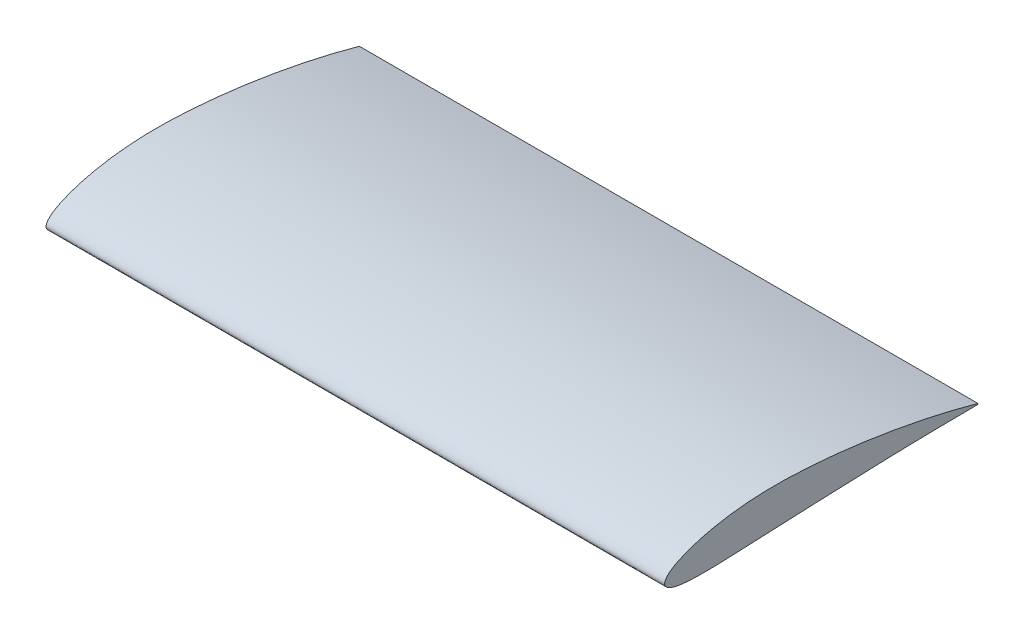
from build123d import *

# Parameters (mm, degrees)
BOSS_EXTRUDE1_DEPTH = 200
SHELL4_DEPTH        = 198.4


# Read off the part's stored shape, not the designer's step: Shell4
with BuildPart() as part:
    # Sketch2 → Boss-Extrude1 (new body)
    with BuildSketch(Plane.YZ):
        with BuildLine():
            Line((0, 0), (-0.263344105, 0))
            add(Edge.make_bspline(
                [(0, 0), (0.459066026, 1.686362772), (1.374982687, 5.050950153), (3.040345111, 11.79119389), (4.880368033, 20.220100989), (6.69419046, 30.358473989), (8.180959946, 40.488987495), (9.241471816, 50.625145633), (9.902902817, 60.760420595), (9.909592193, 69.221469875), (9.442212528, 75.9771391), (8.826589369, 81.050736595), (7.918723829, 86.135299513), (6.826886743, 90.348697601), (5.724176768, 93.725115323), (4.683167586, 96.271012337), (3.557343646, 98.44331039), (2.210659682, 100.328866881), (0.044765725, 101.970256047), (-1.611665434, 100.198592433), (-2.261876263, 98.390784877), (-2.700739943, 96.237810408), (-2.923870526, 93.695152896), (-3.081784432, 90.314927071), (-3.069956573, 86.092208181), (-2.92820834, 81.026757417), (-2.658310189, 75.964880802), (-2.342503562, 69.212441369), (-1.937238587, 60.773333491), (-1.556691614, 50.642805056), (-1.134126639, 40.51553101), (-0.774209635, 30.387287933), (-0.509468098, 20.258233454), (-0.375051203, 11.816976137), (-0.286530734, 5.064463666), (-0.271072843, 1.688124171), (-0.263344105, 0)],
                knots=[0, 0, 0, 0, 0.025304886, 0.050487653, 0.100520433, 0.150190716, 0.199586607, 0.248740009, 0.297715539, 0.346600594, 0.371102737, 0.395726297, 0.420570145, 0.445825119, 0.458702216, 0.471919982, 0.485786003, 0.493461051, 0.506863029, 0.51614777, 0.522766003, 0.535269014, 0.547551134, 0.559786371, 0.584228898, 0.60868081, 0.633151284, 0.657621757, 0.706558114, 0.75548187, 0.804405627, 0.853320224, 0.902221408, 0.951113136, 0.975557228, 1, 1, 1, 1], degree=3))
        make_face()
    extrude(amount=BOSS_EXTRUDE1_DEPTH)

    # Shell4 outline → Shell4 (cut)
    with BuildSketch(Plane.YZ):
        with BuildLine():
            add(Edge.make_bspline(
                [(1.229909583, 11.233204072), (1.259792724, 11.360590547), (1.289612362, 11.487991708), (1.319368458, 11.615407518), (1.349060906, 11.742837688), (1.378689543, 11.870281856), (1.408254283, 11.997740134), (1.437755285, 12.125213335), (1.467192791, 12.252701918), (1.49656654, 12.380204546), (1.525875672, 12.507719636), (1.555120364, 12.63524903), (1.584302543, 12.762795713), (1.613419448, 12.890353922), (1.745480409, 13.470239376), (1.847681658, 13.922729863), (1.94907388, 14.375397136), (2.049654735, 14.828239842), (2.149421882, 15.28125663), (2.248372982, 15.734446147), (2.346505693, 16.187807044), (2.443817676, 16.641337965), (2.540306589, 17.095037562), (2.635970093, 17.54890448), (2.730805847, 18.002937369), (2.82481151, 18.457134876), (2.917984743, 18.91149565), (3.056492434, 19.593279683), (3.102453373, 19.820581376), (3.148202951, 20.047921102), (3.193748261, 20.275311958), (3.239081627, 20.502731215), (3.284200074, 20.73017853), (3.32910992, 20.957678355), (3.373816805, 21.185242861), (3.418318772, 21.412855256), (3.46261158, 21.640496582), (3.506698265, 21.86817944), (3.550585835, 22.095927412), (3.59426776, 22.323706537), (3.681228971, 22.779359505), (3.724507647, 23.007230294), (3.767585292, 23.235145062), (3.810462803, 23.463103482), (3.853141076, 23.691105226), (3.895621011, 23.919149971), (3.937903503, 24.147237382), (3.979989451, 24.375367142), (4.021879752, 24.603538916), (4.063575302, 24.831752383), (4.105077001, 25.060007212), (4.146385744, 25.288303079), (4.187502429, 25.516639655), (4.269353479, 25.973393573), (4.310087844, 26.201810915), (4.350631946, 26.430268312), (4.390986685, 26.658765436), (4.431152958, 26.88730196), (4.471131663, 27.115877555), (4.510923698, 27.344491896), (4.550529962, 27.573144652), (4.589951354, 27.801835497), (4.62918877, 28.030564103), (4.668243109, 28.259330142), (4.70711527, 28.488133287), (4.74580615, 28.716973209), (4.822827146, 29.174725954), (4.861158224, 29.403639754), (4.899299337, 29.632572906), (4.937318423, 29.86166373), (4.974964003, 30.090265851), (5.012908235, 30.320410548), (5.049840992, 30.54754142), (5.087662058, 30.779095142), (5.12434976, 31.00625133), (5.161469948, 31.236516446), (5.198128377, 31.465284457), (5.234693411, 31.694583126), (5.271055963, 31.92379299), (5.379591358, 32.61151584), (5.45120465, 33.070077022), (5.522061807, 33.528717658), (5.592150332, 33.987437919), (5.661457729, 34.446237982), (5.7299715, 34.905118012), (5.79767915, 35.36407819), (5.86456818, 35.82311868), (5.930626094, 36.282239662), (5.995840396, 36.741441302), (6.060198588, 37.200723777), (6.123688173, 37.660087257), (6.186296656, 38.119531916), (6.278868979, 38.808820929), (6.309502529, 39.038603815), (6.339914907, 39.268412684), (6.37008791, 39.498214592), (6.400057248, 39.728106857), (6.429773492, 39.957926575), (6.459257957, 40.187794765), (6.488537031, 40.417781005), (6.517563465, 40.647676021), (6.546330451, 40.877522979), (6.574902484, 41.107613508), (6.603217247, 41.337582334), (6.631305832, 41.567635251), (6.687014735, 42.02778664), (6.714636038, 42.257892961), (6.742024498, 42.488029627), (6.769180423, 42.718196359), (6.796104118, 42.948392879), (6.822795891, 43.178618904), (6.849256049, 43.408874158), (6.875484896, 43.639158357), (6.901482742, 43.869471226), (6.927249891, 44.099812481), (6.952786652, 44.330181846), (6.978093329, 44.560579038), (7.00317023, 44.79100378), (7.052865094, 45.251907802), (7.077483056, 45.482387082), (7.101871855, 45.712893351), (7.126031799, 45.943426328), (7.149963193, 46.173985737), (7.173666344, 46.404571291), (7.19714156, 46.635182718), (7.220389147, 46.865819729), (7.243409412, 47.096482053), (7.266202661, 47.327169403), (7.288769201, 47.557881503), (7.311109339, 47.788618071), (7.333223383, 48.019378828), (7.376999892, 48.480948158), (7.398663398, 48.711766567), (7.420091509, 48.942512842), (7.441340973, 49.17374422), (7.462225343, 49.403558702), (7.483183179, 49.636594053), (7.503453208, 49.864374909), (7.524029384, 50.098742785), (7.543949402, 50.327021117), (7.563874261, 50.559429156), (7.58352188, 50.790029108), (7.602940478, 51.021108888), (7.622131794, 51.252111586), (7.67899804, 51.945122148), (7.715968154, 52.407113529), (7.751966518, 52.869088708), (7.786962121, 53.331047152), (7.820923977, 53.792988335), (7.85382112, 54.254911734), (7.885622609, 54.716816844), (7.916297524, 55.178703155), (7.945814971, 55.640570174), (7.974144074, 56.102417409), (8.001253986, 56.564244382), (8.027113877, 57.026050614), (8.051692943, 57.487835642), (8.098227862, 58.411362367), (8.120182792, 58.873106454), (8.140803752, 59.334815888), (8.16001519, 59.796516367), (8.177916859, 60.258266494), (8.194233799, 60.719691449), (8.209210922, 61.181561535), (8.222700732, 61.643216258), (8.23453299, 62.104460844), (8.244933259, 62.566251522), (8.253646095, 63.027506749), (8.260754868, 63.488898782), (8.266183775, 63.950146225), (8.273630637, 64.872463965), (8.275647706, 65.333526406), (8.27592387, 65.794484955), (8.274424697, 66.255329912), (8.271115798, 66.71605136), (8.265962788, 67.17664004), (8.258931288, 67.637087449), (8.24998694, 68.097385386), (8.239095425, 68.557525388), (8.226222485, 69.017498219), (8.211333919, 69.477293885), (8.194395557, 69.93690235), (8.175373194, 70.396315378), (8.133091733, 71.3147441), (8.109832632, 71.7737904), (8.084426317, 72.232659666), (8.056873938, 72.691330348), (8.02710712, 73.149780391), (7.995154157, 73.608050856), (7.960977641, 74.066048221), (7.924521949, 74.523765765), (7.885802648, 74.981306232), (7.844811884, 75.438563477), (7.801468846, 75.895379426), (7.755793845, 76.352081193), (7.707765463, 76.808413236), (7.632165036, 77.492454118), (7.606372049, 77.720388858), (7.579984142, 77.948242933), (7.55299924, 78.176014572), (7.525415268, 78.403701995), (7.497230152, 78.631303434), (7.468441815, 78.858817102), (7.439048184, 79.08624124), (7.409047183, 79.313574056), (7.378436738, 79.540813789), (7.347214772, 79.767958654), (7.315379212, 79.995006882), (7.282927982, 80.221956694), (7.23332452, 80.562231129), (7.216635154, 80.675635648), (7.199795012, 80.788980343), (7.182787398, 80.902393967), (7.165638521, 81.015696738), (7.148340392, 81.128917774), (7.130875964, 81.24215704), (7.113251292, 81.355374716), (7.095476759, 81.468496384), (7.077541771, 81.581573632), (7.059435892, 81.694663326), (7.041176083, 81.8076566), (7.022748176, 81.920627019), (6.985562534, 82.14646947), (6.966804118, 82.25934528), (6.94787878, 82.37217505), (6.928785195, 82.484958151), (6.909522033, 82.597693961), (6.89008797, 82.710381848), (6.870481678, 82.823021192), (6.850701831, 82.935611361), (6.830747101, 83.048151734), (6.810616162, 83.160641681), (6.790307688, 83.273080578), (6.76982035, 83.385467797), (6.749152823, 83.497802713), (6.707454737, 83.722366686), (6.686424178, 83.834595741), (6.665210785, 83.946771246), (6.643813239, 84.058892589), (6.62223022, 84.170959145), (6.600460412, 84.28297031), (6.578502493, 84.394925449), (6.556355148, 84.506823968), (6.534017054, 84.618665227), (6.511486896, 84.730448628), (6.488763352, 84.842173542), (6.465845106, 84.95383936), (6.442730837, 85.065445461), (6.396107618, 85.288536998), (6.372599387, 85.400017649), (6.348884752, 85.51148476), (6.325008817, 85.622672284), (6.300820029, 85.73438517), (6.276620727, 85.845088287), (6.252048359, 85.95649453), (6.227268992, 86.067899979), (6.202442541, 86.178503978), (6.177214963, 86.289929517), (6.151910157, 86.400734314), (6.126343242, 86.511722744), (6.1005825, 86.622600373), (6.022671503, 86.955097057), (5.969899131, 87.17655199), (5.916293116, 87.397794375), (5.861851526, 87.61882119), (5.806572425, 87.839629408), (5.750453882, 88.060216008), (5.693493962, 88.280577962), (5.635690731, 88.50071225), (5.577042255, 88.720615844), (5.517546601, 88.940285723), (5.457201834, 89.159718861), (5.396006022, 89.378912233), (5.333957231, 89.597862817), (5.2553276, 89.87124378), (5.239548241, 89.925904612), (5.223715419, 89.980550036), (5.207829104, 90.035180007), (5.191889265, 90.089794476), (5.175895872, 90.144393399), (5.159848895, 90.198976724), (5.143748304, 90.253544412), (5.127594067, 90.308096408), (5.111386155, 90.362632672), (5.095124538, 90.417153153), (5.078809185, 90.471657806), (5.062440065, 90.526146583), (5.029594233, 90.635092294), (5.013117085, 90.689551353), (4.99659741, 90.743951911), (4.979949467, 90.798597923), (4.963458298, 90.852514356), (4.946657907, 90.907253937), (4.929970063, 90.961423535), (4.91326504, 91.015436729), (4.896326358, 91.070010277), (4.879537352, 91.12388061), (4.862563949, 91.178137936), (4.845591923, 91.232172833), (4.828551348, 91.286209843), (4.777268947, 91.448171545), (4.742859625, 91.555969067), (4.70822302, 91.663584643), (4.673352932, 91.771013285), (4.638243187, 91.87825001), (4.602887633, 91.985289858), (4.567280148, 92.092127859), (4.531414634, 92.198759081), (4.495285018, 92.305178573), (4.458885254, 92.411381421), (4.422209321, 92.517362702), (4.385251224, 92.623117516), (4.348004993, 92.728640966), (4.291694531, 92.886571772), (4.27285173, 92.939153546), (4.253926776, 92.991699766), (4.234958025, 93.044093309), (4.215848119, 93.096614221), (4.196724847, 93.148898365), (4.177537049, 93.201078553), (4.158194693, 93.253409039), (4.138791596, 93.305633309), (4.1193626, 93.357648182), (4.099772779, 93.409823442), (4.080144477, 93.461825179), (4.06041586, 93.513818849), (4.020790638, 93.617699714), (4.000891916, 93.669592591), (3.980906356, 93.721438481), (3.960833235, 93.773237951), (3.940671827, 93.824991569), (3.920421408, 93.876699903), (3.900081253, 93.928363522), (3.879650637, 93.979982994), (3.859128836, 94.031558885), (3.838515124, 94.083091765), (3.817808777, 94.134582201), (3.79700907, 94.186030762), (3.776115279, 94.237438015), (3.734138076, 94.340171042), (3.713054668, 94.391496818), (3.691875712, 94.442782441), (3.670600468, 94.494028495), (3.649228197, 94.545235556), (3.627758159, 94.59640422), (3.606189613, 94.647535054), (3.584521821, 94.698628658), (3.562754041, 94.749685598), (3.540885534, 94.800706471), (3.51891556, 94.851691851), (3.49684338, 94.902642326), (3.474668252, 94.953558477), (3.441250031, 95.029882091), (3.430084699, 95.055314863), (3.418893348, 95.080739276), (3.407675884, 95.106155407), (3.396432214, 95.13156332), (3.385162242, 95.156963107), (3.373865875, 95.182354817), (3.362543019, 95.207738553), (3.35119358, 95.233114361), (3.339817463, 95.258482337), (3.328414575, 95.28384254), (3.316984821, 95.309195053), (3.305528108, 95.334539945), (3.282560574, 95.38521464), (3.271050422, 95.410542849), (3.259506956, 95.435877903), (3.247961299, 95.461148428), (3.236332851, 95.486536185), (3.224738727, 95.511780224), (3.213113542, 95.537022677), (3.201387997, 95.562419321), (3.189682248, 95.58770674), (3.178013991, 95.612842178), (3.166224295, 95.638173746), (3.154473954, 95.663350688), (3.142679773, 95.688552837), (3.083607695, 95.814431427), (3.035978891, 95.914814275), (2.987978001, 96.014840737), (2.939604465, 96.114474342), (2.890858105, 96.213678499), (2.841739127, 96.312416517), (2.792248122, 96.410651574), (2.742386062, 96.50834676), (2.692154305, 96.605465027), (2.64155459, 96.701969237), (2.590589042, 96.797822122), (2.539260167, 96.892986314), (2.487570857, 96.987424326), (2.409501151, 97.127935678), (2.383388698, 97.174581897), (2.357187459, 97.221032528), (2.330897901, 97.267282877), (2.304520529, 97.313328269), (2.278055881, 97.359164), (2.251504535, 97.404785414), (2.224867104, 97.450187801), (2.198144236, 97.495366511), (2.171336616, 97.540316845), (2.144444968, 97.585034145), (2.117470048, 97.62951373), (2.090412652, 97.673750934), (2.05648885, 97.728738626), (2.049698986, 97.739720724), (2.042904032, 97.750687309), (2.036104001, 97.761638309), (2.029298909, 97.772573652), (2.022488769, 97.783493261), (2.015673596, 97.794397072), (2.008853403, 97.805285002), (2.002028204, 97.816156989), (1.995198013, 97.827012951), (1.988362845, 97.837852822), (1.981522714, 97.848676526), (1.974677633, 97.859483992), (1.9609776, 97.881066302), (1.954118784, 97.891847274), (1.947299039, 97.902542424), (1.940264418, 97.913551605), (1.93372599, 97.923757633), (1.926621049, 97.934826305), (1.919852251, 97.945343865), (1.913183357, 97.955678727), (1.906128964, 97.966591315), (1.899495265, 97.976819213), (1.892603109, 97.987424727), (1.885823938, 97.99782653), (1.87902182, 98.008236847), (1.858636847, 98.039351281), (1.84506231, 98.059959233), (1.831499942, 98.080434687), (1.817946424, 98.100780232), (1.804398387, 98.120998527), (1.790852418, 98.141092338), (1.777305056, 98.161064472), (1.763752795, 98.180917867), (1.75019208, 98.200655491), (1.736619312, 98.22028044), (1.723030843, 98.239795854), (1.709422982, 98.25920498), (1.695791988, 98.278511132), (1.654818248, 98.336130873), (1.627394524, 98.374145636), (1.599832648, 98.411788864), (1.572101305, 98.4490885), (1.544168142, 98.486073404), (1.515999794, 98.522773158), (1.487561906, 98.559217915), (1.458819157, 98.595438184), (1.429735282, 98.631464702), (1.400273101, 98.667328203), (1.370394535, 98.703059288), (1.340060637, 98.738688217), (1.309231611, 98.774244745), (1.270025645, 98.818636243), (1.262151756, 98.827510998), (1.254241746, 98.836385659), (1.246297664, 98.845257804), (1.238319763, 98.854126919), (1.23030602, 98.862994949), (1.22225423, 98.871863996), (1.214163834, 98.880734436), (1.206035986, 98.889604749), (1.197871737, 98.898473569), (1.189669527, 98.907342286), (1.181424588, 98.916215755), (1.173134155, 98.925096661), (1.156493412, 98.94283942), (1.148140903, 98.951703504), (1.139757156, 98.960559047), (1.131343066, 98.969404807), (1.122899532, 98.978239536), (1.114427451, 98.987061997), (1.105927721, 98.995870935), (1.097401238, 99.004665119), (1.0888489, 99.013443291), (1.080271605, 99.02220422), (1.07167025, 99.030946651), (1.063045732, 99.039669346), (1.05439895, 99.048371059), (1.028394498, 99.07440952), (1.010973131, 99.091679776), (0.993474053, 99.108851496), (0.975904796, 99.125914919), (0.958273067, 99.14286035), (0.940586748, 99.159678144), (0.922853896, 99.176358729), (0.905082744, 99.192892576), (0.8872817, 99.209270234), (0.869459349, 99.225482295), (0.851624448, 99.241519424), (0.833785932, 99.257372336), (0.815952912, 99.273031813), (0.746628729, 99.333168811), (0.695246473, 99.376157065), (0.644218204, 99.417230999), (0.593785058, 99.456178818), (0.544209051, 99.492794306), (0.495775931, 99.526880075), (0.448796187, 99.558253028), (0.403606837, 99.586749954), (0.360574357, 99.612233756), (0.32009737, 99.63460218), (0.282606427, 99.653800854), (0.248557415, 99.669841132), (0.218414842, 99.682820545), (0.192621393, 99.69293969)],
                knots=[0.054152956, 0.054152956, 0.054152956, 0.054152956, 0.054152956, 0.054152956, 0.054152956, 0.054152956, 0.054152956, 0.054152956, 0.054152956, 0.054152956, 0.054152956, 0.054152956, 0.054152956, 0.063043564, 0.063043564, 0.063043564, 0.063043564, 0.063043564, 0.063043564, 0.063043564, 0.063043564, 0.063043564, 0.063043564, 0.063043564, 0.063043564, 0.063043564, 0.094565346, 0.094565346, 0.094565346, 0.094565346, 0.094565346, 0.094565346, 0.094565346, 0.094565346, 0.094565346, 0.094565346, 0.094565346, 0.094565346, 0.094565346, 0.110326237, 0.110326237, 0.110326237, 0.110326237, 0.110326237, 0.110326237, 0.110326237, 0.110326237, 0.110326237, 0.110326237, 0.110326237, 0.110326237, 0.110326237, 0.126087127, 0.126087127, 0.126087127, 0.126087127, 0.126087127, 0.126087127, 0.126087127, 0.126087127, 0.126087127, 0.126087127, 0.126087127, 0.126087127, 0.126087127, 0.141848018, 0.141848018, 0.141848018, 0.141848018, 0.141848018, 0.141848018, 0.141848018, 0.141848018, 0.141848018, 0.141848018, 0.141848018, 0.141848018, 0.141848018, 0.157608909, 0.157608909, 0.157608909, 0.157608909, 0.157608909, 0.157608909, 0.157608909, 0.157608909, 0.157608909, 0.157608909, 0.157608909, 0.157608909, 0.157608909, 0.189130691, 0.189130691, 0.189130691, 0.189130691, 0.189130691, 0.189130691, 0.189130691, 0.189130691, 0.189130691, 0.189130691, 0.189130691, 0.189130691, 0.189130691, 0.204891582, 0.204891582, 0.204891582, 0.204891582, 0.204891582, 0.204891582, 0.204891582, 0.204891582, 0.204891582, 0.204891582, 0.204891582, 0.204891582, 0.204891582, 0.220652473, 0.220652473, 0.220652473, 0.220652473, 0.220652473, 0.220652473, 0.220652473, 0.220652473, 0.220652473, 0.220652473, 0.220652473, 0.220652473, 0.220652473, 0.236413364, 0.236413364, 0.236413364, 0.236413364, 0.236413364, 0.236413364, 0.236413364, 0.236413364, 0.236413364, 0.236413364, 0.236413364, 0.236413364, 0.236413364, 0.252174255, 0.252174255, 0.252174255, 0.252174255, 0.252174255, 0.252174255, 0.252174255, 0.252174255, 0.252174255, 0.252174255, 0.252174255, 0.252174255, 0.252174255, 0.283696037, 0.283696037, 0.283696037, 0.283696037, 0.283696037, 0.283696037, 0.283696037, 0.283696037, 0.283696037, 0.283696037, 0.283696037, 0.283696037, 0.283696037, 0.315217819, 0.315217819, 0.315217819, 0.315217819, 0.315217819, 0.315217819, 0.315217819, 0.315217819, 0.315217819, 0.315217819, 0.315217819, 0.315217819, 0.315217819, 0.3467396, 0.3467396, 0.3467396, 0.3467396, 0.3467396, 0.3467396, 0.3467396, 0.3467396, 0.3467396, 0.3467396, 0.3467396, 0.3467396, 0.3467396, 0.378261382, 0.378261382, 0.378261382, 0.378261382, 0.378261382, 0.378261382, 0.378261382, 0.378261382, 0.378261382, 0.378261382, 0.378261382, 0.378261382, 0.378261382, 0.394022273, 0.394022273, 0.394022273, 0.394022273, 0.394022273, 0.394022273, 0.394022273, 0.394022273, 0.394022273, 0.394022273, 0.394022273, 0.394022273, 0.394022273, 0.401902719, 0.401902719, 0.401902719, 0.401902719, 0.401902719, 0.401902719, 0.401902719, 0.401902719, 0.401902719, 0.401902719, 0.401902719, 0.401902719, 0.401902719, 0.409783164, 0.409783164, 0.409783164, 0.409783164, 0.409783164, 0.409783164, 0.409783164, 0.409783164, 0.409783164, 0.409783164, 0.409783164, 0.409783164, 0.409783164, 0.41766361, 0.41766361, 0.41766361, 0.41766361, 0.41766361, 0.41766361, 0.41766361, 0.41766361, 0.41766361, 0.41766361, 0.41766361, 0.41766361, 0.41766361, 0.425544055, 0.425544055, 0.425544055, 0.425544055, 0.425544055, 0.425544055, 0.425544055, 0.425544055, 0.425544055, 0.425544055, 0.425544055, 0.425544055, 0.425544055, 0.441304946, 0.441304946, 0.441304946, 0.441304946, 0.441304946, 0.441304946, 0.441304946, 0.441304946, 0.441304946, 0.441304946, 0.441304946, 0.441304946, 0.441304946, 0.445245169, 0.445245169, 0.445245169, 0.445245169, 0.445245169, 0.445245169, 0.445245169, 0.445245169, 0.445245169, 0.445245169, 0.445245169, 0.445245169, 0.445245169, 0.449185391, 0.449185391, 0.449185391, 0.449185391, 0.449185391, 0.449185391, 0.449185391, 0.449185391, 0.449185391, 0.449185391, 0.449185391, 0.449185391, 0.449185391, 0.457065837, 0.457065837, 0.457065837, 0.457065837, 0.457065837, 0.457065837, 0.457065837, 0.457065837, 0.457065837, 0.457065837, 0.457065837, 0.457065837, 0.457065837, 0.46100606, 0.46100606, 0.46100606, 0.46100606, 0.46100606, 0.46100606, 0.46100606, 0.46100606, 0.46100606, 0.46100606, 0.46100606, 0.46100606, 0.46100606, 0.464946282, 0.464946282, 0.464946282, 0.464946282, 0.464946282, 0.464946282, 0.464946282, 0.464946282, 0.464946282, 0.464946282, 0.464946282, 0.464946282, 0.464946282, 0.468886505, 0.468886505, 0.468886505, 0.468886505, 0.468886505, 0.468886505, 0.468886505, 0.468886505, 0.468886505, 0.468886505, 0.468886505, 0.468886505, 0.468886505, 0.470856617, 0.470856617, 0.470856617, 0.470856617, 0.470856617, 0.470856617, 0.470856617, 0.470856617, 0.470856617, 0.470856617, 0.470856617, 0.470856617, 0.470856617, 0.472826728, 0.472826728, 0.472826728, 0.472826728, 0.472826728, 0.472826728, 0.472826728, 0.472826728, 0.472826728, 0.472826728, 0.472826728, 0.472826728, 0.472826728, 0.480707173, 0.480707173, 0.480707173, 0.480707173, 0.480707173, 0.480707173, 0.480707173, 0.480707173, 0.480707173, 0.480707173, 0.480707173, 0.480707173, 0.480707173, 0.484647396, 0.484647396, 0.484647396, 0.484647396, 0.484647396, 0.484647396, 0.484647396, 0.484647396, 0.484647396, 0.484647396, 0.484647396, 0.484647396, 0.484647396, 0.485632452, 0.485632452, 0.485632452, 0.485632452, 0.485632452, 0.485632452, 0.485632452, 0.485632452, 0.485632452, 0.485632452, 0.485632452, 0.485632452, 0.485632452, 0.486617507, 0.486617507, 0.486617507, 0.486617507, 0.486617507, 0.486617507, 0.486617507, 0.486617507, 0.486617507, 0.486617507, 0.486617507, 0.486617507, 0.486617507, 0.488587619, 0.488587619, 0.488587619, 0.488587619, 0.488587619, 0.488587619, 0.488587619, 0.488587619, 0.488587619, 0.488587619, 0.488587619, 0.488587619, 0.488587619, 0.492527842, 0.492527842, 0.492527842, 0.492527842, 0.492527842, 0.492527842, 0.492527842, 0.492527842, 0.492527842, 0.492527842, 0.492527842, 0.492527842, 0.492527842, 0.493512897, 0.493512897, 0.493512897, 0.493512897, 0.493512897, 0.493512897, 0.493512897, 0.493512897, 0.493512897, 0.493512897, 0.493512897, 0.493512897, 0.493512897, 0.494497953, 0.494497953, 0.494497953, 0.494497953, 0.494497953, 0.494497953, 0.494497953, 0.494497953, 0.494497953, 0.494497953, 0.494497953, 0.494497953, 0.494497953, 0.496468064, 0.496468064, 0.496468064, 0.496468064, 0.496468064, 0.496468064, 0.496468064, 0.496468064, 0.496468064, 0.496468064, 0.496468064, 0.496468064, 0.496468064, 0.502162927, 0.502162927, 0.502162927, 0.502162927, 0.502162927, 0.502162927, 0.502162927, 0.502162927, 0.502162927, 0.502162927, 0.502162927, 0.502162927, 0.502162927, 0.502162927, 0.502162927], degree=14))
            add(Edge.make_bspline(
                [(0.192621393, 99.69293969), (0.185991198, 99.687611534), (0.179088374, 99.681936328), (0.171929352, 99.675916465), (0.164530528, 99.669554974), (0.156907888, 99.66285564), (0.149076983, 99.655822943), (0.141052909, 99.648461987), (0.132850308, 99.640778436), (0.124483378, 99.632778459), (0.115965891, 99.624468668), (0.107311237, 99.615856067), (0.098532464, 99.606948006), (0.089642342, 99.597752127), (0.070498141, 99.577570958), (0.060216557, 99.566508154), (0.049825987, 99.555099844), (0.039343199, 99.543358262), (0.028784439, 99.531295959), (0.018165421, 99.518925776), (0.007501335, 99.506260895), (-0.003193159, 99.493314766), (-0.013903926, 99.480101191), (-0.02461736, 99.466634243), (-0.035320382, 99.452928331), (-0.046000441, 99.438998158), (-0.056645511, 99.424858742), (-0.077842683, 99.396192073), (-0.088392206, 99.381668464), (-0.098896409, 99.366943367), (-0.109299136, 99.352108016), (-0.119655459, 99.337065973), (-0.129917008, 99.321896935), (-0.140045546, 99.306664266), (-0.150078538, 99.291303742), (-0.160021129, 99.275806677), (-0.169798627, 99.260300405), (-0.179407755, 99.244792009), (-0.188956869, 99.229100048), (-0.198255902, 99.213549475), (-0.225821487, 99.166623699), (-0.243701664, 99.13506691), (-0.261132679, 99.1031788), (-0.278157912, 99.070902097), (-0.294816785, 99.038180947), (-0.31114514, 99.004961228), (-0.327175619, 98.971190857), (-0.34293805, 98.936820095), (-0.358459818, 98.901801867), (-0.373766253, 98.866092059), (-0.388881006, 98.829649836), (-0.40382643, 98.792437946), (-0.418623962, 98.754423034), (-0.440629768, 98.696152404), (-0.447933447, 98.676520612), (-0.45520807, 98.656676837), (-0.4624562, 98.636617546), (-0.46968043, 98.616339391), (-0.476883381, 98.595839241), (-0.484067706, 98.575114129), (-0.491236085, 98.554161321), (-0.498391228, 98.53297824), (-0.505535877, 98.511562541), (-0.512672801, 98.489912046), (-0.519804799, 98.468024793), (-0.5269347, 98.445899003), (-0.535848028, 98.417941623), (-0.537630744, 98.412335129), (-0.539413558, 98.406713597), (-0.541196519, 98.401077002), (-0.542979673, 98.395425327), (-0.544763069, 98.389758542), (-0.546546754, 98.384076638), (-0.548330777, 98.378379577), (-0.550115184, 98.372667352), (-0.551900024, 98.366939931), (-0.553685344, 98.361197298), (-0.555471193, 98.355439427), (-0.557257617, 98.349666299), (-0.560831714, 98.338089484), (-0.562621349, 98.332279331), (-0.564395878, 98.326506038), (-0.566230684, 98.320520565), (-0.567932455, 98.314962448), (-0.569819691, 98.308777477), (-0.57157752, 98.303009788), (-0.57330902, 98.297315419), (-0.57519684, 98.291091068), (-0.576945996, 98.285316749), (-0.578742862, 98.279369435), (-0.580531914, 98.273437511), (-0.582315972, 98.26750968), (-0.58766179, 98.249711391), (-0.591214729, 98.237834084), (-0.594756736, 98.225945054), (-0.598287822, 98.21404435), (-0.601807994, 98.202132035), (-0.605317262, 98.19020815), (-0.608815635, 98.178272768), (-0.612303123, 98.166325922), (-0.615779734, 98.154367688), (-0.619245477, 98.142398103), (-0.622700361, 98.130417233), (-0.626144396, 98.118425127), (-0.62957759, 98.106421841), (-0.660378857, 97.998292138), (-0.687064455, 97.90146456), (-0.713061879, 97.80395306), (-0.738376636, 97.705786045), (-0.763014604, 97.606991958), (-0.786982033, 97.507599279), (-0.810285548, 97.407636532), (-0.832932144, 97.30713227), (-0.854929192, 97.206115095), (-0.876284433, 97.104613637), (-0.897005982, 97.002656574), (-0.917102326, 96.900272615), (-0.936582325, 96.797490511), (-0.964891656, 96.642763319), (-0.974176149, 96.591096027), (-0.983310165, 96.539338498), (-0.992294712, 96.48749523), (-1.001130768, 96.435571023), (-1.009819471, 96.383569749), (-1.01836213, 96.331494248), (-1.026760129, 96.279346989), (-1.035014793, 96.227130905), (-1.043127289, 96.174850082), (-1.051098625, 96.12250972), (-1.05892983, 96.070114992), (-1.066622366, 96.017668288), (-1.081735367, 95.912660549), (-1.089156155, 95.860097167), (-1.096443398, 95.807473889), (-1.103599264, 95.754790328), (-1.110625921, 95.702046101), (-1.117525536, 95.649240821), (-1.124300277, 95.596374106), (-1.130952311, 95.543445568), (-1.137483807, 95.490454824), (-1.143896931, 95.437401488), (-1.150193852, 95.384285176), (-1.156376738, 95.331105502), (-1.162447755, 95.277862082), (-1.180331706, 95.117939427), (-1.191815855, 95.011068216), (-1.202879083, 94.903938433), (-1.213539096, 94.796547733), (-1.223813742, 94.688893887), (-1.233721013, 94.580974787), (-1.24327904, 94.472788434), (-1.252506098, 94.364332959), (-1.261420603, 94.255606596), (-1.270041115, 94.146607709), (-1.278386332, 94.037334771), (-1.286475099, 93.927786376), (-1.2943264, 93.817961234), (-1.303867601, 93.680332409), (-1.305761555, 93.652798454), (-1.307646637, 93.625181913), (-1.309505408, 93.597746656), (-1.31137061, 93.569993719), (-1.31321527, 93.542370497), (-1.315037167, 93.51488692), (-1.316855496, 93.487228582), (-1.318662007, 93.459554139), (-1.320446211, 93.432029907), (-1.322225127, 93.404355687), (-1.323987101, 93.376751098), (-1.325736855, 93.34912284), (-1.329209807, 93.293864901), (-1.330933121, 93.266232641), (-1.332643303, 93.238597113), (-1.334340384, 93.210958341), (-1.336024395, 93.183316342), (-1.337695367, 93.15567115), (-1.33935333, 93.128022769), (-1.340998316, 93.100371244), (-1.342630354, 93.072716576), (-1.344249476, 93.045058805), (-1.345855713, 93.017397942), (-1.347449096, 92.989734015), (-1.349029654, 92.962067044), (-1.35373295, 92.87905707), (-1.356817307, 92.823705006), (-1.359850738, 92.768341039), (-1.36283349, 92.71296535), (-1.365765812, 92.657578118), (-1.368647949, 92.602179527), (-1.371480151, 92.546769749), (-1.374262665, 92.491348974), (-1.376995737, 92.435917374), (-1.379679616, 92.380475133), (-1.38231455, 92.32502243), (-1.384900785, 92.269559445), (-1.387438569, 92.214086358), (-1.394907312, 92.047637332), (-1.399693807, 91.936627693), (-1.404288773, 91.825601798), (-1.408696283, 91.714489671), (-1.412916124, 91.603388472), (-1.416950267, 91.492262117), (-1.420802538, 91.381055933), (-1.424475032, 91.269818896), (-1.427967681, 91.158605016), (-1.431281612, 91.047360735), (-1.434421447, 90.936029264), (-1.437392053, 90.824688813), (-1.440193134, 90.713306138), (-1.445464564, 90.490467115), (-1.447934641, 90.379010708), (-1.450241861, 90.267517478), (-1.452389006, 90.155987504), (-1.454378855, 90.044420849), (-1.45621419, 89.932817603), (-1.457897792, 89.821177818), (-1.45943244, 89.709501594), (-1.460820917, 89.597788979), (-1.462066002, 89.486040068), (-1.463170477, 89.37425492), (-1.464137122, 89.262433618), (-1.464968718, 89.150576231), (-1.466367374, 88.926789438), (-1.466934433, 88.814860038), (-1.46737204, 88.70289472), (-1.46768301, 88.590893569), (-1.46787016, 88.47885667), (-1.467936305, 88.366784108), (-1.467884262, 88.254675969), (-1.467716847, 88.142532336), (-1.467436876, 88.030353297), (-1.467047165, 87.918138935), (-1.46655053, 87.805889336), (-1.465949788, 87.693604584), (-1.465247754, 87.581284765), (-1.463646735, 87.356575164), (-1.462747724, 87.24419322), (-1.46175365, 87.131698996), (-1.460664558, 87.019550432), (-1.459491154, 86.906150483), (-1.458222023, 86.795509703), (-1.456874816, 86.680010584), (-1.455452273, 86.570873219), (-1.453926487, 86.455163969), (-1.452363736, 86.344494216), (-1.450689783, 86.230937917), (-1.448970555, 86.118369022), (-1.447176679, 86.005614745), (-1.44159131, 85.667404068), (-1.437593383, 85.441936202), (-1.433321063, 85.216474601), (-1.428774301, 84.991019606), (-1.423953054, 84.765571571), (-1.418857273, 84.540130825), (-1.413486913, 84.314697735), (-1.407841927, 84.08927262), (-1.401922269, 83.86385585), (-1.395727892, 83.638447749), (-1.38925875, 83.413048676), (-1.382514797, 83.187658969), (-1.375495986, 82.962278975), (-1.364555413, 82.62422407), (-1.36083983, 82.511541616), (-1.357055514, 82.398861719), (-1.353202461, 82.286184423), (-1.349280665, 82.173509771), (-1.34529012, 82.060837804), (-1.341230819, 81.94816857), (-1.337102758, 81.835502105), (-1.33290593, 81.72283846), (-1.32864033, 81.610177671), (-1.324305952, 81.497519786), (-1.31990279, 81.384864846), (-1.315430839, 81.272212894), (-1.306349344, 81.046915053), (-1.30173985, 80.93427726), (-1.297059521, 80.821585096), (-1.292312744, 80.708869457), (-1.287502493, 80.596141569), (-1.282630213, 80.483390324), (-1.277697495, 80.370606248), (-1.27270684, 80.257792744), (-1.267661123, 80.144958779), (-1.262562658, 80.032105484), (-1.257413044, 79.919223732), (-1.252214232, 79.806309151), (-1.246969526, 79.693376518), (-1.231102391, 79.354495142), (-1.220347557, 79.128471455), (-1.209433966, 78.902344233), (-1.198379634, 78.676112705), (-1.187202609, 78.449776101), (-1.175920971, 78.223333644), (-1.16455283, 77.996784568), (-1.153116329, 77.770128086), (-1.141629642, 77.543363429), (-1.130110973, 77.31648981), (-1.118578558, 77.089506454), (-1.107050666, 76.862412572), (-1.095545596, 76.635207382), (-1.081215699, 76.351060776), (-1.078352442, 76.294225117), (-1.07549135, 76.237382042), (-1.072634424, 76.180521487), (-1.069781034, 76.123683936), (-1.066929983, 76.066821614), (-1.064082696, 76.00991706), (-1.061241577, 75.95303142), (-1.05840627, 75.89619273), (-1.05557406, 75.839336661), (-1.052744885, 75.782438167), (-1.049922116, 75.725594526), (-1.047102448, 75.668727438), (-1.041471804, 75.555005184), (-1.038660615, 75.498145476), (-1.035853493, 75.441287191), (-1.033050371, 75.384430329), (-1.030251184, 75.327574897), (-1.027455865, 75.270720892), (-1.024664347, 75.213868324), (-1.021876565, 75.157017187), (-1.019092451, 75.100167493), (-1.01631194, 75.043319238), (-1.013534965, 74.986472428), (-1.010761459, 74.929627064), (-1.007991357, 74.87278315), (-0.999691063, 74.702255765), (-0.994170881, 74.588576651), (-0.988663516, 74.474903368), (-0.983168439, 74.361235938), (-0.97768512, 74.247574384), (-0.972213028, 74.133918726), (-0.966751633, 74.020268988), (-0.961300407, 73.906625191), (-0.955858818, 73.792987357), (-0.950426337, 73.679355508), (-0.945002434, 73.565729666), (-0.939586579, 73.452109853), (-0.934178242, 73.338496091), (-0.923375544, 73.111280712), (-0.917981183, 72.997679095), (-0.912593281, 72.884083573), (-0.90721131, 72.770494169), (-0.90183474, 72.6569109), (-0.896463043, 72.543333796), (-0.89109569, 72.429762869), (-0.885732152, 72.316198152), (-0.880371901, 72.202639656), (-0.875014407, 72.089087411), (-0.869659142, 71.975541434), (-0.864305578, 71.86200175), (-0.858953184, 71.748468378), (-0.848249682, 71.521414307), (-0.842898426, 71.407895573), (-0.837548034, 71.29436529), (-0.832196112, 71.180912565), (-0.826842243, 71.067316481), (-0.821491796, 70.953871861), (-0.816136282, 70.8404625), (-0.810772449, 70.726883614), (-0.805411204, 70.613352511), (-0.800052436, 70.499950464), (-0.794683832, 70.386369152), (-0.789319615, 70.272891599), (-0.783952299, 70.159377111), (-0.757112803, 69.591816205), (-0.735626987, 69.137725756), (-0.71414086, 68.683593014), (-0.692668333, 68.229417409), (-0.671223317, 67.775198373), (-0.649819721, 67.320935331), (-0.628471456, 66.866627721), (-0.607192431, 66.412274966), (-0.585996557, 65.957876503), (-0.564897743, 65.503431757), (-0.5439099, 65.048940161), (-0.523046938, 64.594401145), (-0.502322767, 64.139814139), (-0.471465561, 63.457860791), (-0.461217982, 63.230534406), (-0.451010475, 63.003175464), (-0.44084444, 62.775852526), (-0.43072176, 62.548465278), (-0.420644623, 62.321068625), (-0.410614314, 62.093707689), (-0.400632066, 61.866312469), (-0.3907004, 61.638854278), (-0.380821887, 61.411429363), (-0.370996586, 61.184044748), (-0.361224776, 60.95652417), (-0.351515122, 60.729071787), (-0.332204377, 60.274173574), (-0.322604189, 60.046734779), (-0.313057084, 59.819306386), (-0.303560962, 59.591888482), (-0.294113721, 59.364481157), (-0.28471326, 59.137084497), (-0.275357479, 58.909698595), (-0.266044276, 58.682323535), (-0.256771551, 58.454959409), (-0.247537202, 58.227606305), (-0.238339129, 58.00026431), (-0.229175231, 57.772933515), (-0.220043406, 57.545614007), (-0.192737848, 56.863689612), (-0.174653979, 56.409118855), (-0.156673193, 55.954594313), (-0.138778736, 55.500116688), (-0.120953855, 55.045686694), (-0.103181796, 54.591305028), (-0.085445807, 54.136972411), (-0.067729134, 53.682689533), (-0.050015023, 53.228457117), (-0.032286722, 52.774275858), (-0.014527477, 52.32014647), (0.003279466, 51.866069656), (0.021150859, 51.412046124), (0.057056053, 50.504107039), (0.075086067, 50.050230137), (0.093253131, 49.596182163), (0.111395697, 49.142029233), (0.129755582, 48.688513687), (0.147970902, 48.233392486), (0.166424442, 47.780599831), (0.184741074, 47.32519238), (0.203180643, 46.871871311), (0.221567863, 46.417195195), (0.239968526, 45.963093139), (0.258342472, 45.508753598), (0.276685328, 45.054419666), (0.304133214, 44.372855664), (0.313271473, 44.145658268), (0.322397211, 43.918451416), (0.331508942, 43.691235047), (0.34060518, 43.464009099), (0.349684441, 43.236773515), (0.358745239, 43.00952823), (0.367786089, 42.782273186), (0.376805504, 42.555008321), (0.385802001, 42.327733576), (0.394774092, 42.100448888), (0.403720294, 41.873154197), (0.41263912, 41.645849443), (0.43041905, 41.191219687), (0.439279774, 40.963895629), (0.448111411, 40.736561005), (0.456910437, 40.509210477), (0.465674863, 40.281851092), (0.474404454, 40.054492024), (0.483099469, 39.827134917), (0.491759733, 39.599774179), (0.500384536, 39.372404437), (0.508973105, 39.145027213), (0.517525006, 38.917649162), (0.526040027, 38.690271609), (0.53451765, 38.462884056), (0.559836702, 37.780713983), (0.576564444, 37.325917078), (0.593136854, 36.871103262), (0.609550228, 36.416272477), (0.62580086, 35.961424665), (0.641885045, 35.506559771), (0.657799078, 35.051677738), (0.673539254, 34.596778509), (0.689101869, 34.141862026), (0.704483216, 33.686928234), (0.719679591, 33.231977074), (0.73468729, 32.777008492), (0.749502605, 32.322022429), (0.778741062, 31.41201523), (0.793163323, 30.956994775), (0.807389622, 30.501958845), (0.821407729, 30.046889118), (0.835216232, 29.591814788), (0.848817736, 29.136748624), (0.862212242, 28.681673747), (0.875397284, 28.226576146), (0.888370984, 27.771465948), (0.901133164, 27.316359266), (0.913683603, 26.861247887), (0.926020649, 26.406112063), (0.938143297, 25.950978122), (0.961958334, 25.040688793), (0.973649734, 24.585533334), (0.985132585, 24.130391808), (0.996368873, 23.675143858), (1.007456527, 23.220157162), (1.01822093, 22.76467557), (1.028855291, 22.309739801), (1.03925923, 21.854543218), (1.049353965, 21.398975062), (1.059349806, 20.944297486), (1.069041731, 20.488662585), (1.078522237, 20.033567945), (1.087788071, 19.57834771), (1.105901279, 18.66797829), (1.114749251, 18.212811905), (1.123396042, 17.757664018), (1.1318491, 17.302534801), (1.140115875, 16.847424428), (1.148203817, 16.392333068), (1.156120375, 15.937260898), (1.163872999, 15.482208086), (1.171469139, 15.027174809), (1.178916243, 14.572161236), (1.186221762, 14.117167541), (1.193393145, 13.662193897), (1.200437841, 13.207240476), (1.209015228, 12.64379247), (1.210660369, 12.535278651), (1.212298828, 12.426765994), (1.213930703, 12.318254502), (1.215556096, 12.209744178), (1.217175108, 12.101235023), (1.21878784, 11.992727041), (1.220394393, 11.884220233), (1.221994868, 11.775714601), (1.223589366, 11.667210149), (1.225177988, 11.558706878), (1.226760835, 11.450204791), (1.228338008, 11.34170389), (1.229909583, 11.233204072)],
                knots=[0.510671999, 0.510671999, 0.510671999, 0.510671999, 0.510671999, 0.510671999, 0.510671999, 0.510671999, 0.510671999, 0.510671999, 0.510671999, 0.510671999, 0.510671999, 0.510671999, 0.510671999, 0.512371297, 0.512371297, 0.512371297, 0.512371297, 0.512371297, 0.512371297, 0.512371297, 0.512371297, 0.512371297, 0.512371297, 0.512371297, 0.512371297, 0.512371297, 0.514291095, 0.514291095, 0.514291095, 0.514291095, 0.514291095, 0.514291095, 0.514291095, 0.514291095, 0.514291095, 0.514291095, 0.514291095, 0.514291095, 0.514291095, 0.516210893, 0.516210893, 0.516210893, 0.516210893, 0.516210893, 0.516210893, 0.516210893, 0.516210893, 0.516210893, 0.516210893, 0.516210893, 0.516210893, 0.516210893, 0.52005049, 0.52005049, 0.52005049, 0.52005049, 0.52005049, 0.52005049, 0.52005049, 0.52005049, 0.52005049, 0.52005049, 0.52005049, 0.52005049, 0.52005049, 0.521970288, 0.521970288, 0.521970288, 0.521970288, 0.521970288, 0.521970288, 0.521970288, 0.521970288, 0.521970288, 0.521970288, 0.521970288, 0.521970288, 0.521970288, 0.522450237, 0.522450237, 0.522450237, 0.522450237, 0.522450237, 0.522450237, 0.522450237, 0.522450237, 0.522450237, 0.522450237, 0.522450237, 0.522450237, 0.522450237, 0.522930187, 0.522930187, 0.522930187, 0.522930187, 0.522930187, 0.522930187, 0.522930187, 0.522930187, 0.522930187, 0.522930187, 0.522930187, 0.522930187, 0.522930187, 0.523890086, 0.523890086, 0.523890086, 0.523890086, 0.523890086, 0.523890086, 0.523890086, 0.523890086, 0.523890086, 0.523890086, 0.523890086, 0.523890086, 0.523890086, 0.531569278, 0.531569278, 0.531569278, 0.531569278, 0.531569278, 0.531569278, 0.531569278, 0.531569278, 0.531569278, 0.531569278, 0.531569278, 0.531569278, 0.531569278, 0.535408874, 0.535408874, 0.535408874, 0.535408874, 0.535408874, 0.535408874, 0.535408874, 0.535408874, 0.535408874, 0.535408874, 0.535408874, 0.535408874, 0.535408874, 0.53924847, 0.53924847, 0.53924847, 0.53924847, 0.53924847, 0.53924847, 0.53924847, 0.53924847, 0.53924847, 0.53924847, 0.53924847, 0.53924847, 0.53924847, 0.546927662, 0.546927662, 0.546927662, 0.546927662, 0.546927662, 0.546927662, 0.546927662, 0.546927662, 0.546927662, 0.546927662, 0.546927662, 0.546927662, 0.546927662, 0.54884746, 0.54884746, 0.54884746, 0.54884746, 0.54884746, 0.54884746, 0.54884746, 0.54884746, 0.54884746, 0.54884746, 0.54884746, 0.54884746, 0.54884746, 0.550767258, 0.550767258, 0.550767258, 0.550767258, 0.550767258, 0.550767258, 0.550767258, 0.550767258, 0.550767258, 0.550767258, 0.550767258, 0.550767258, 0.550767258, 0.554606854, 0.554606854, 0.554606854, 0.554606854, 0.554606854, 0.554606854, 0.554606854, 0.554606854, 0.554606854, 0.554606854, 0.554606854, 0.554606854, 0.554606854, 0.562286046, 0.562286046, 0.562286046, 0.562286046, 0.562286046, 0.562286046, 0.562286046, 0.562286046, 0.562286046, 0.562286046, 0.562286046, 0.562286046, 0.562286046, 0.569965239, 0.569965239, 0.569965239, 0.569965239, 0.569965239, 0.569965239, 0.569965239, 0.569965239, 0.569965239, 0.569965239, 0.569965239, 0.569965239, 0.569965239, 0.577644431, 0.577644431, 0.577644431, 0.577644431, 0.577644431, 0.577644431, 0.577644431, 0.577644431, 0.577644431, 0.577644431, 0.577644431, 0.577644431, 0.577644431, 0.585323623, 0.585323623, 0.585323623, 0.585323623, 0.585323623, 0.585323623, 0.585323623, 0.585323623, 0.585323623, 0.585323623, 0.585323623, 0.585323623, 0.585323623, 0.600682007, 0.600682007, 0.600682007, 0.600682007, 0.600682007, 0.600682007, 0.600682007, 0.600682007, 0.600682007, 0.600682007, 0.600682007, 0.600682007, 0.600682007, 0.608361199, 0.608361199, 0.608361199, 0.608361199, 0.608361199, 0.608361199, 0.608361199, 0.608361199, 0.608361199, 0.608361199, 0.608361199, 0.608361199, 0.608361199, 0.616040392, 0.616040392, 0.616040392, 0.616040392, 0.616040392, 0.616040392, 0.616040392, 0.616040392, 0.616040392, 0.616040392, 0.616040392, 0.616040392, 0.616040392, 0.631398776, 0.631398776, 0.631398776, 0.631398776, 0.631398776, 0.631398776, 0.631398776, 0.631398776, 0.631398776, 0.631398776, 0.631398776, 0.631398776, 0.631398776, 0.635238372, 0.635238372, 0.635238372, 0.635238372, 0.635238372, 0.635238372, 0.635238372, 0.635238372, 0.635238372, 0.635238372, 0.635238372, 0.635238372, 0.635238372, 0.639077968, 0.639077968, 0.639077968, 0.639077968, 0.639077968, 0.639077968, 0.639077968, 0.639077968, 0.639077968, 0.639077968, 0.639077968, 0.639077968, 0.639077968, 0.64675716, 0.64675716, 0.64675716, 0.64675716, 0.64675716, 0.64675716, 0.64675716, 0.64675716, 0.64675716, 0.64675716, 0.64675716, 0.64675716, 0.64675716, 0.654436352, 0.654436352, 0.654436352, 0.654436352, 0.654436352, 0.654436352, 0.654436352, 0.654436352, 0.654436352, 0.654436352, 0.654436352, 0.654436352, 0.654436352, 0.662115545, 0.662115545, 0.662115545, 0.662115545, 0.662115545, 0.662115545, 0.662115545, 0.662115545, 0.662115545, 0.662115545, 0.662115545, 0.662115545, 0.662115545, 0.692832313, 0.692832313, 0.692832313, 0.692832313, 0.692832313, 0.692832313, 0.692832313, 0.692832313, 0.692832313, 0.692832313, 0.692832313, 0.692832313, 0.692832313, 0.708190698, 0.708190698, 0.708190698, 0.708190698, 0.708190698, 0.708190698, 0.708190698, 0.708190698, 0.708190698, 0.708190698, 0.708190698, 0.708190698, 0.708190698, 0.723549082, 0.723549082, 0.723549082, 0.723549082, 0.723549082, 0.723549082, 0.723549082, 0.723549082, 0.723549082, 0.723549082, 0.723549082, 0.723549082, 0.723549082, 0.754265851, 0.754265851, 0.754265851, 0.754265851, 0.754265851, 0.754265851, 0.754265851, 0.754265851, 0.754265851, 0.754265851, 0.754265851, 0.754265851, 0.754265851, 0.784982619, 0.784982619, 0.784982619, 0.784982619, 0.784982619, 0.784982619, 0.784982619, 0.784982619, 0.784982619, 0.784982619, 0.784982619, 0.784982619, 0.784982619, 0.800341004, 0.800341004, 0.800341004, 0.800341004, 0.800341004, 0.800341004, 0.800341004, 0.800341004, 0.800341004, 0.800341004, 0.800341004, 0.800341004, 0.800341004, 0.815699388, 0.815699388, 0.815699388, 0.815699388, 0.815699388, 0.815699388, 0.815699388, 0.815699388, 0.815699388, 0.815699388, 0.815699388, 0.815699388, 0.815699388, 0.846416157, 0.846416157, 0.846416157, 0.846416157, 0.846416157, 0.846416157, 0.846416157, 0.846416157, 0.846416157, 0.846416157, 0.846416157, 0.846416157, 0.846416157, 0.877132925, 0.877132925, 0.877132925, 0.877132925, 0.877132925, 0.877132925, 0.877132925, 0.877132925, 0.877132925, 0.877132925, 0.877132925, 0.877132925, 0.877132925, 0.907849694, 0.907849694, 0.907849694, 0.907849694, 0.907849694, 0.907849694, 0.907849694, 0.907849694, 0.907849694, 0.907849694, 0.907849694, 0.907849694, 0.907849694, 0.938566463, 0.938566463, 0.938566463, 0.938566463, 0.938566463, 0.938566463, 0.938566463, 0.938566463, 0.938566463, 0.938566463, 0.938566463, 0.938566463, 0.938566463, 0.94589332, 0.94589332, 0.94589332, 0.94589332, 0.94589332, 0.94589332, 0.94589332, 0.94589332, 0.94589332, 0.94589332, 0.94589332, 0.94589332, 0.94589332, 0.94589332, 0.94589332], degree=14))
        make_face()
    extrude(amount=SHELL4_DEPTH, mode=Mode.SUBTRACT)


solid = part.part
